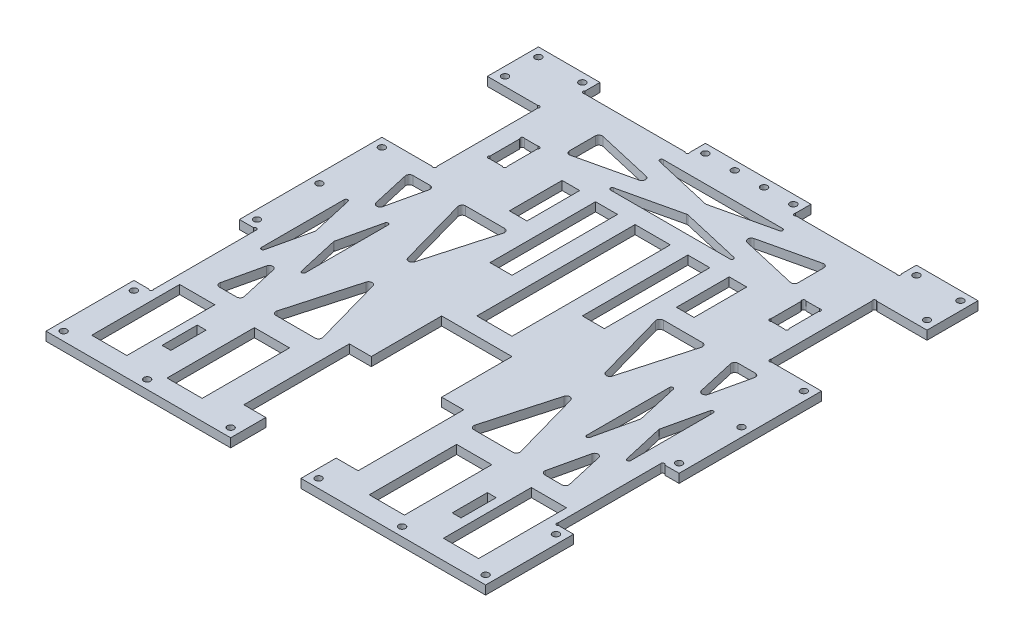
from build123d import *

# Parameters (mm, degrees)
SKETCH1_W           = 317.5
SKETCH1_H           = 355.6
BOSS_EXTRUDE1_DEPTH = 6.35
SKETCH2_W           = 50.8
SKETCH2_H           = 152.4
CUT_EXTRUDE1_DEPTH  = 239.442288615
SKETCH3_W           = 25.4
SKETCH3_H           = 76.2
SKETCH3_W_2         = 12.7
SKETCH3_H_2         = 25.4
CUT_EXTRUDE2_DEPTH  = 239.442288615
SKETCH4_W           = 12.7
SKETCH4_H           = 76.2
SKETCH4_W_2         = 76.2
SKETCH4_H_2         = 12.7
SKETCH4_W_3         = 15.875
CUT_EXTRUDE3_DEPTH  = 239.442288615
SKETCH5_W           = 25.4
SKETCH5_H           = 63.089423232
SKETCH5_H_2         = 114.3
SKETCH5_W_2         = 12.7
SKETCH5_H_3         = 38.1
SKETCH5_H_4         = 63.5
SKETCH5_W_3         = 6.35
SKETCH5_H_5         = 25.4
CUT_EXTRUDE4_DEPTH  = 239.442288615
SKETCH7_R           = 2.413
CUT_EXTRUDE6_DEPTH  = 239.442288615
SKETCH8_R           = 1.27
CUT_EXTRUDE7_DEPTH  = 239.442288615
FILLET1_R           = 1.27
FILLET2_R           = 2.54


with BuildPart() as part:
    # Sketch1 → Boss-Extrude1 (new body)
    with BuildSketch(Plane(origin=(0, 0, 0), x_dir=(1, 0, 0), z_dir=(0, 1, 0))):
        Rectangle(SKETCH1_W, SKETCH1_H)
    extrude(amount=BOSS_EXTRUDE1_DEPTH)

    # Sketch2 → Cut-Extrude1 (cut, through all)
    with BuildSketch(Plane(origin=(0, 6.35, 0), x_dir=(1, 0, 0), z_dir=(0, 1, 0))):
        with Locations((0, -101.6)):
            Rectangle(SKETCH2_W, SKETCH2_H)
    extrude(amount=-CUT_EXTRUDE1_DEPTH, mode=Mode.SUBTRACT)

    # Sketch3 → Cut-Extrude2 (cut, through all)
    with BuildSketch(Plane(origin=(0, 6.35, 0), x_dir=(1, 0, 0), z_dir=(0, 1, 0))):
        with Locations((133.35, 102.87)):
            Rectangle(SKETCH3_W, SKETCH3_H)
        with Locations((101.6, 102.87)):
            Rectangle(SKETCH3_W_2, SKETCH3_H_2)
        with Locations((-101.6, 102.87)):
            Rectangle(SKETCH3_W_2, SKETCH3_H_2)
        with Locations((-133.35, 102.87)):
            Rectangle(SKETCH3_W, SKETCH3_H)
    extrude(amount=-CUT_EXTRUDE2_DEPTH, mode=Mode.SUBTRACT)

    # Sketch4 → Cut-Extrude3 (cut, through all)
    with BuildSketch(Plane(origin=(0, 6.35, 0), x_dir=(1, 0, 0), z_dir=(0, 1, 0))):
        with Locations((-152.4, 102.87)):
            Rectangle(SKETCH4_W, SKETCH4_H)
        with Locations((-152.4, -76.2)):
            Rectangle(SKETCH4_W, SKETCH4_H)
        with Locations((152.4, 102.87)):
            Rectangle(SKETCH4_W, SKETCH4_H)
        with Locations((152.4, -76.2)):
            Rectangle(SKETCH4_W, SKETCH4_H)
        with Locations((76.2, 171.45)):
            Rectangle(SKETCH4_W_2, SKETCH4_H_2)
        with Locations((-76.2, 171.45)):
            Rectangle(SKETCH4_W_2, SKETCH4_H_2)
        with Locations((-33.3375, -114.3)):
            Rectangle(SKETCH4_W_3, SKETCH4_H)
        with Locations((33.3375, 63.5)):
            Rectangle(SKETCH4_W_3, SKETCH4_H)
        with Locations((-33.3375, 63.5)):
            Rectangle(SKETCH4_W_3, SKETCH4_H)
        with Locations((33.3375, -114.3)):
            Rectangle(SKETCH4_W_3, SKETCH4_H)
    extrude(amount=-CUT_EXTRUDE3_DEPTH, mode=Mode.SUBTRACT)

    # Sketch5 → Cut-Extrude4 (cut, through all)
    with BuildSketch(Plane(origin=(0, 6.35, 0), x_dir=(1, 0, 0), z_dir=(0, 1, 0))):
        with Locations((-73.025, -131.874711616)):
            Rectangle(SKETCH5_W, SKETCH5_H)
        Polygon((-117.475, -46.432505999), (-126.838066818, -87.63), (-108.111933182, -87.63), align=None)
        Polygon((-133.35, 23.417494001), (-133.35, -58.977494001), (-123.986933182, -17.78), align=None)
        Polygon((-101.6, 23.417494001), (-110.963066818, -17.78), (-101.6, -58.977494001), align=None)
        Polygon((-126.838066818, 52.07), (-117.475, 10.872505999), (-108.111933182, 52.07), align=None)
        Polygon((0, 126.833110246), (-54.310144398, 114.3), (54.310144398, 114.3), align=None)
        Polygon((-82.55, 145.883110246), (-82.55, 120.816889754), (-28.239855602, 133.35), align=None)
        Polygon((82.55, 145.883110246), (28.239855602, 133.35), (82.55, 120.816889754), align=None)
        Polygon((-54.310144398, 152.4), (0, 139.866889754), (54.310144398, 152.4), align=None)
        with Locations((0, 44.45)):
            Rectangle(SKETCH5_W, SKETCH5_H_2)
        with Locations((-60.325, 83.82)):
            Rectangle(SKETCH5_W_2, SKETCH5_H_3)
        with Locations((60.325, 83.82)):
            Rectangle(SKETCH5_W_2, SKETCH5_H_3)
        with Locations((-127, -132.08)):
            Rectangle(SKETCH5_W, SKETCH5_H_4)
        Polygon((-71.4375, -22.791352996), (-88.9, -84.952705992), (-53.975, -84.952705992), align=None)
        with Locations((-104.775, -132.08)):
            Rectangle(SKETCH5_W_3, SKETCH5_H_5)
        Polygon((-53.975, 52.07), (-88.9, 52.07), (-71.4375, -10.091352996), align=None)
    cut_extrude4 = extrude(amount=-CUT_EXTRUDE4_DEPTH, mode=Mode.SUBTRACT)

    # Mirror1: Cut-Extrude4 across plane
    add(cut_extrude4.mirror(Plane(origin=(0, 0, 0), x_dir=(0, 0, 1), z_dir=(1, 0, 0))), mode=Mode.SUBTRACT)

    # Sketch7 → Cut-Extrude6 (cut, through all)
    with BuildSketch(Plane(origin=(0, 6.35, 0), x_dir=(1, 0, 0), z_dir=(0, 1, 0))):
        with Locations((-152.4, -171.45)):
            Circle(SKETCH7_R)
        with Locations((-152.4, 171.45)):
            Circle(SKETCH7_R)
        with Locations((-120.65, 171.45)):
            Circle(SKETCH7_R)
        with Locations((-152.4, 147.32)):
            Circle(SKETCH7_R)
        with Locations((-31.75, 171.45)):
            Circle(SKETCH7_R)
        with Locations((-10.583333333, 171.45)):
            Circle(SKETCH7_R)
        with Locations((10.583333333, 171.45)):
            Circle(SKETCH7_R)
        with Locations((31.75, 171.45)):
            Circle(SKETCH7_R)
        with Locations((-31.75, -171.45)):
            Circle(SKETCH7_R)
        with Locations((-92.075, -171.45)):
            Circle(SKETCH7_R)
        with Locations((-152.4, -120.65)):
            Circle(SKETCH7_R)
        with Locations((-152.4, -31.75)):
            Circle(SKETCH7_R)
        with Locations((-152.4, 58.42)):
            Circle(SKETCH7_R)
        with Locations((-152.4, 13.335)):
            Circle(SKETCH7_R)
        with Locations((31.75, -171.45)):
            Circle(SKETCH7_R)
        with Locations((152.4, 13.335)):
            Circle(SKETCH7_R)
        with Locations((152.4, 58.42)):
            Circle(SKETCH7_R)
        with Locations((152.4, -31.75)):
            Circle(SKETCH7_R)
        with Locations((152.4, -120.65)):
            Circle(SKETCH7_R)
        with Locations((92.075, -171.45)):
            Circle(SKETCH7_R)
        with Locations((152.4, 147.32)):
            Circle(SKETCH7_R)
        with Locations((120.65, 171.45)):
            Circle(SKETCH7_R)
        with Locations((152.4, 171.45)):
            Circle(SKETCH7_R)
        with Locations((152.4, -171.45)):
            Circle(SKETCH7_R)
    extrude(amount=-CUT_EXTRUDE6_DEPTH, mode=Mode.SUBTRACT)

    # Sketch8 → Cut-Extrude7 (cut, through all)
    with BuildSketch(Plane(origin=(0, 6.35, 0), x_dir=(1, 0, 0), z_dir=(0, 1, 0))):
        with Locations((-39.09938383, 165.88366572)):
            Circle(SKETCH8_R)
        with Locations((-113.539841326, 166.117378391)):
            Circle(SKETCH8_R)
        with Locations((-121.560019166, 140.084130304)):
            Circle(SKETCH8_R)
        with Locations((-121.565556473, 65.650145639)):
            Circle(SKETCH8_R)
        with Locations((-147.253032713, -38.506954901)):
            Circle(SKETCH8_R)
        with Locations((-147.044413998, -113.510037468)):
            Circle(SKETCH8_R)
        with Locations((-107.194291917, 114.549311364)):
            Circle(SKETCH8_R)
        with Locations((-96.034081321, 114.570942203)):
            Circle(SKETCH8_R)
        with Locations((-107.184450657, 91.18332828)):
            Circle(SKETCH8_R)
        with Locations((-96.208355861, 91.003339093)):
            Circle(SKETCH8_R)
    cut_extrude7 = extrude(amount=-CUT_EXTRUDE7_DEPTH, mode=Mode.SUBTRACT)

    # Mirror2: Cut-Extrude7 across plane
    add(cut_extrude7.mirror(Plane(origin=(0, 0, 0), x_dir=(0, 0, 1), z_dir=(1, 0, 0))), mode=Mode.SUBTRACT)

    # Fillet1
    fillet1_edges = [part.edges().sort_by_distance(p)[0] for p in [
        (-101.6, 3.175, 58.977494001),
        (-110.963066818, 3.175, 17.78),
        (-101.6, 3.175, -23.417494001),
        (-133.35, 3.175, -23.417494001),
        (-123.986933182, 3.175, 17.78),
        (-133.35, 3.175, 58.977494001),
        (133.35, 3.175, -23.417494001),
        (133.35, 3.175, 58.977494001),
        (123.986933182, 3.175, 17.78),
        (101.6, 3.175, -23.417494001),
        (110.963066818, 3.175, 17.78),
        (101.6, 3.175, 58.977494001),
        (54.310144398, 3.175, -152.4),
        (-54.310144398, 3.175, -152.4),
        (54.310144398, 3.175, -114.3),
        (-54.310144398, 3.175, -114.3),
    ]]
    fillet(fillet1_edges, radius=FILLET1_R)

    # Fillet2
    fillet2_edges = [part.edges().sort_by_distance(p)[0] for p in [
        (-126.838066818, 3.175, 87.63),
        (-108.111933182, 3.175, 87.63),
        (-117.475, 3.175, 46.432505999),
        (-28.239855602, 3.175, -133.35),
        (-82.55, 3.175, -120.816889754),
        (-82.55, 3.175, -145.883110246),
        (-88.9, 3.175, -52.07),
        (-71.4375, 3.175, 10.091352996),
        (-53.975, 3.175, -52.07),
        (-71.4375, 3.175, 22.791352996),
        (-88.9, 3.175, 84.952705992),
        (-53.975, 3.175, 84.952705992),
        (-126.838066818, 3.175, -52.07),
        (-117.475, 3.175, -10.872505999),
        (-108.111933182, 3.175, -52.07),
        (126.838066818, 3.175, 87.63),
        (108.111933182, 3.175, 87.63),
        (117.475, 3.175, 46.432505999),
        (88.9, 3.175, 84.952705992),
        (53.975, 3.175, 84.952705992),
        (71.4375, 3.175, 22.791352996),
        (117.475, 3.175, -10.872505999),
        (108.111933182, 3.175, -52.07),
        (126.838066818, 3.175, -52.07),
        (71.4375, 3.175, 10.091352996),
        (88.9, 3.175, -52.07),
        (53.975, 3.175, -52.07),
        (28.239855602, 3.175, -133.35),
        (82.55, 3.175, -120.816889754),
        (82.55, 3.175, -145.883110246),
        (0, 3.175, -139.866889754),
        (0, 3.175, -126.833110246),
    ]]
    fillet(fillet2_edges, radius=FILLET2_R)


solid = part.part
